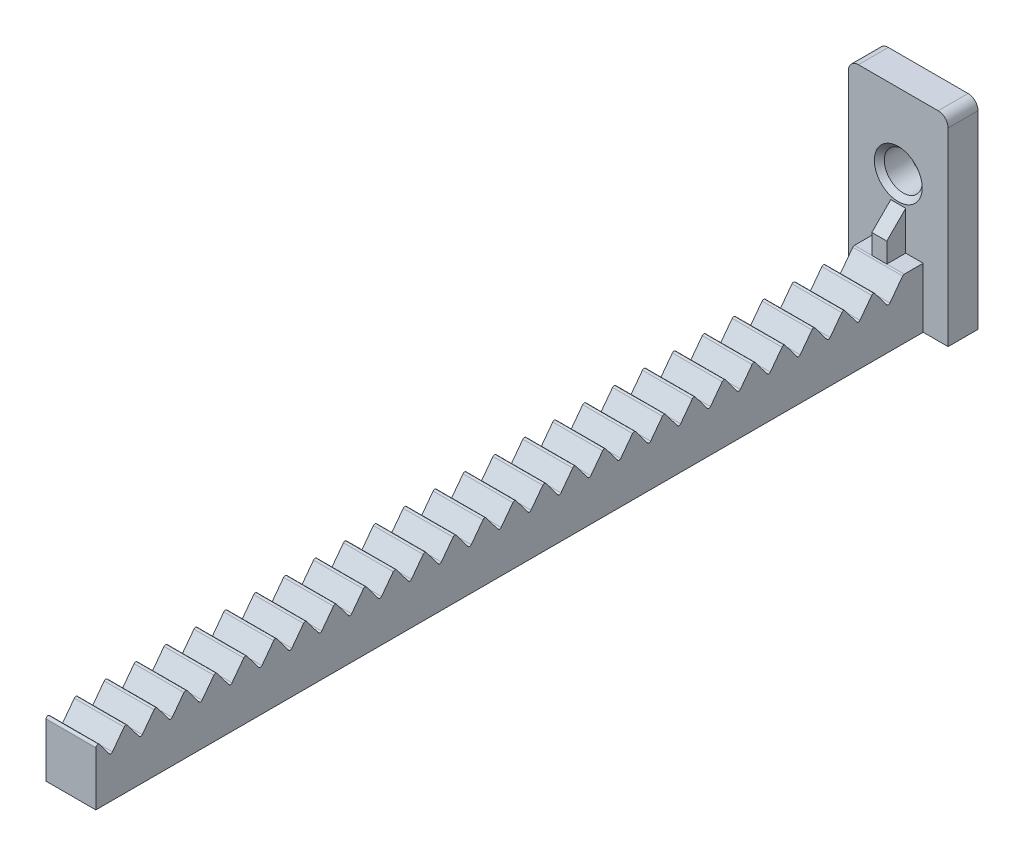
from build123d import *

# Parameters (mm, degrees)
ESQUISSE1_W                      = 83
ESQUISSE1_H                      = 6
BOSS_EXTRU_1_DEPTH               = 5
ENL_V_MAT_EXTRU_1_DEPTH          = 5
CONG_1_R                         = 0.2
R_P_TITION_LIN_AIRE4_COUNT       = 9
R_P_TITION_LIN_AIRE4_PITCH       = 9
CONG_1_OF_R_P_TITION_LIN_AIRE4_R = 0.2
CONG_2_R                         = 0.2
ESQUISSE3_W                      = 10
ESQUISSE3_H                      = 6
BOSS_EXTRU_2_DEPTH               = 3
ESQUISSE4_W                      = 10
ESQUISSE4_H                      = 3
BOSS_EXTRU_3_DEPTH               = 14
ESQUISSE5_R                      = 1.9
ENL_V_MAT_EXTRU_2_DEPTH          = 15
CONG_3_R                         = 1
CHANFREIN1_SIZE                  = 0.5
ESQUISSE6_W                      = 1.5
ESQUISSE6_H                      = 1.9
BOSS_EXTRU_4_DEPTH               = 4
CHANFREIN2_SIZE                  = 2


with BuildPart() as part:
    # Esquisse1 → Boss.-Extru.1 (new body)
    with BuildSketch(Plane(origin=(0, 0, 0), x_dir=(0, 0, -1), z_dir=(1, 0, 0))):
        Rectangle(ESQUISSE1_W, ESQUISSE1_H)
    extrude(amount=BOSS_EXTRU_1_DEPTH)

    # Esquisse2 → Enlèv. mat.-Extru.1 (cut)
    with BuildSketch(Plane(origin=(5, 0, 0), x_dir=(0, 0, -1), z_dir=(1, 0, 0))):
        Polygon((-38.5, 3), (-41.5, 3), (-40, 1), align=None)
        Polygon((-35.5, 3), (-38.5, 3), (-37, 1), align=None)
        Polygon((-32.5, 3), (-35.5, 3), (-34, 1), align=None)
    enl_v_mat_extru_1 = extrude(amount=-ENL_V_MAT_EXTRU_1_DEPTH, mode=Mode.SUBTRACT)

    # Congé1
    cong_1_edges = [part.edges().sort_by_distance(p)[0] for p in [
        (2.5, 1, 40),
        (2.5, 3, 38.5),
        (2.5, 1, 34),
        (2.5, 1, 37),
        (2.5, 3, 35.5),
    ]]
    fillet(cong_1_edges, radius=CONG_1_R)

    # Répétition linéaire4: Enlèv. mat.-Extru.1 ×9
    with Locations(*[(0, 0, -i * R_P_TITION_LIN_AIRE4_PITCH) for i in range(1, R_P_TITION_LIN_AIRE4_COUNT)]):
        add(enl_v_mat_extru_1, mode=Mode.SUBTRACT)

    # Congé1 of Répétition linéaire4
    cong_1_of_r_p_tition_lin_aire4_edges = [part.edges().sort_by_distance(p)[0] for p in [
        (2.5, 1, 31),
        (2.5, 3, 29.5),
        (2.5, 1, 25),
        (2.5, 1, 28),
        (2.5, 3, 26.5),
        (2.5, 1, 22),
        (2.5, 3, 20.5),
        (2.5, 1, 16),
        (2.5, 1, 19),
        (2.5, 3, 17.5),
        (2.5, 1, 13),
        (2.5, 3, 11.5),
        (2.5, 1, 7),
        (2.5, 1, 10),
        (2.5, 3, 8.5),
        (2.5, 1, 4),
        (2.5, 3, 2.5),
        (2.5, 1, -2),
        (2.5, 1, 1),
        (2.5, 3, -0.5),
        (2.5, 1, -5),
        (2.5, 3, -6.5),
        (2.5, 1, -11),
        (2.5, 1, -8),
        (2.5, 3, -9.5),
        (2.5, 1, -14),
        (2.5, 3, -15.5),
        (2.5, 1, -20),
        (2.5, 1, -17),
        (2.5, 3, -18.5),
        (2.5, 1, -23),
        (2.5, 3, -24.5),
        (2.5, 1, -29),
        (2.5, 1, -26),
        (2.5, 3, -27.5),
        (2.5, 1, -32),
        (2.5, 3, -33.5),
        (2.5, 1, -38),
        (2.5, 1, -35),
        (2.5, 3, -36.5),
    ]]
    fillet(cong_1_of_r_p_tition_lin_aire4_edges, radius=CONG_1_OF_R_P_TITION_LIN_AIRE4_R)

    # Congé2
    cong_2_edges = [part.edges().sort_by_distance(p)[0] for p in [
        (2.5, 3, 23.5),
        (2.5, 3, 5.5),
        (2.5, 3, -12.5),
        (2.5, 3, -30.5),
        (2.5, 3, 14.5),
        (2.5, 3, -3.5),
        (2.5, 3, 32.5),
        (2.5, 3, -21.5),
        (2.5, 3, -39.5),
        (2.5, 3, 41.5),
    ]]
    fillet(cong_2_edges, radius=CONG_2_R)

    # Esquisse3 → Boss.-Extru.2 (add)
    with BuildSketch(Plane(origin=(0, 0, -41.5), x_dir=(-1, 0, 0), z_dir=(0, 0, -1))):
        with Locations((-2.5, 0)):
            Rectangle(ESQUISSE3_W, ESQUISSE3_H)
    extrude(amount=BOSS_EXTRU_2_DEPTH)

    # Esquisse4 → Boss.-Extru.3 (add)
    with BuildSketch(Plane(origin=(0, 3, 0), x_dir=(1, 0, 0), z_dir=(0, 1, 0))):
        with Locations((2.5, 43)):
            Rectangle(ESQUISSE4_W, ESQUISSE4_H)
    extrude(amount=BOSS_EXTRU_3_DEPTH)

    # Esquisse5 → Enlèv. mat.-Extru.2 (cut)
    with BuildSketch(Plane(origin=(0, 0, -44.5), x_dir=(-1, 0, 0), z_dir=(0, 0, -1))):
        with Locations((-2.5, 9.5)):
            Circle(ESQUISSE5_R)
    extrude(amount=-ENL_V_MAT_EXTRU_2_DEPTH, mode=Mode.SUBTRACT)

    # Congé3
    cong_3_edges = [part.edges().sort_by_distance(p)[0] for p in [
        (-2.5, 17, -43),
        (7.5, 17, -43),
    ]]
    fillet(cong_3_edges, radius=CONG_3_R)

    # Chanfrein1
    chanfrein1_edges = [part.edges().sort_by_distance(p)[0] for p in [
        (4.4, 9.5, -41.5),
    ]]
    chamfer(chanfrein1_edges, length=CHANFREIN1_SIZE)

    # Esquisse6 → Boss.-Extru.4 (add)
    with BuildSketch(Plane(origin=(0, 3, 0), x_dir=(1, 0, 0), z_dir=(0, 1, 0))):
        with Locations((2.5, 40.55)):
            Rectangle(ESQUISSE6_W, ESQUISSE6_H)
    extrude(amount=BOSS_EXTRU_4_DEPTH)

    # Chanfrein2
    # the kernel refuses this chamfer: 2 mm, written as the material it takes off along each edge
    with BuildSketch(Plane(origin=(-3.393365976, 7, -39.6), x_dir=(0, 0.02749587661058651, -0.9996219169112968), z_dir=(1, 0, 0))) as chanfrein2_piece_1_section:
        Polygon((CHANFREIN2_SIZE * 0.999621916911, -CHANFREIN2_SIZE * 0.0274958766106), (-CHANFREIN2_SIZE * 0.0274958766106, -CHANFREIN2_SIZE * 0.999621916911), (0, 0), align=None)
    chanfrein2_piece_1 = extrude(amount=11.786731952, mode=Mode.PRIVATE)
    chanfrein2_piece_1 = split(chanfrein2_piece_1, bisect_by=Plane(origin=(2.5, 6.33491081, -41.5), z_dir=(0, 0, 1)), keep=Keep.TOP, mode=Mode.PRIVATE)
    add(chanfrein2_piece_1, mode=Mode.SUBTRACT)


solid = part.part
